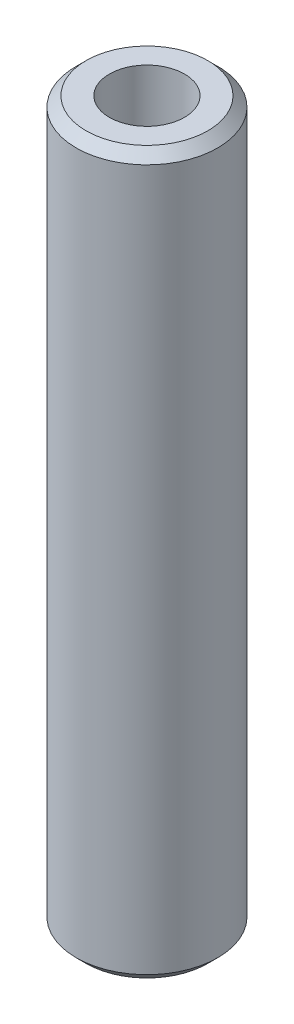
from build123d import *

# Parameters (mm, degrees)
SKETCH1_R           = 17.5
BOSS_EXTRUDE1_DEPTH = 178.356466411
SKETCH2_R           = 9.29110883
CUT_EXTRUDE1_DEPTH  = 181.065346779
CHAMFER1_SIZE       = 2.446690843


with BuildPart() as part:
    # Sketch1 → Boss-Extrude1 (new body)
    with BuildSketch(Plane(origin=(0, 0, 0), x_dir=(1, 0, 0), z_dir=(0, 1, 0))):
        Circle(SKETCH1_R)
    extrude(amount=BOSS_EXTRUDE1_DEPTH)

    # Sketch2 → Cut-Extrude1 (cut, through all)
    with BuildSketch(Plane(origin=(0, 0, 0), x_dir=(1, 0, 0), z_dir=(0, 1, 0))):
        Circle(SKETCH2_R)
    extrude(amount=CUT_EXTRUDE1_DEPTH, mode=Mode.SUBTRACT)

    # Chamfer1
    chamfer1_edges = [part.edges().sort_by_distance(p)[0] for p in [
        (-17.5, 178.356466411, 0),
        (-17.5, 0, 0),
    ]]
    chamfer(chamfer1_edges, length=CHAMFER1_SIZE)


solid = part.part
